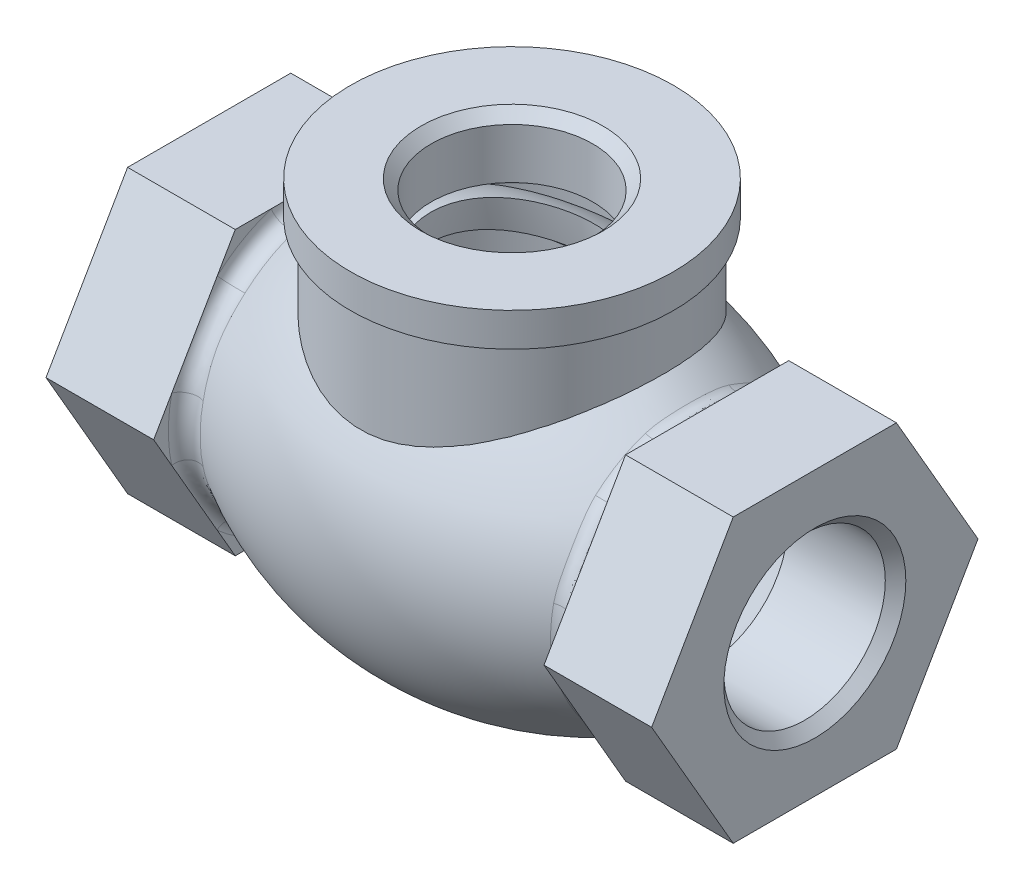
from build123d import *

# Parameters (mm, degrees)
EXTRUDE_1_DEPTH               = 16
HOLE_WIZARD_M27_1_D           = 24
HOLE_WIZARD_M27_1_CSINK_D     = 27.05
HOLE_WIZARD_M27_1_CSINK_ANGLE = 90
FILLET_1_R                    = 2


with BuildPart() as part:
    # 草图2 → 旋转1 (revolve)
    with BuildSketch(Plane.XY, mode=Mode.PRIVATE) as revolve_1_sk:
        with BuildLine():
            Line((-29, 18.552167896), (-29, 13.730823709))
            ThreePointArc((-29, 13.730823709), (0, 23), (29, 13.730823709))
            Line((29, 13.730823709), (29, 18.552167896))
            ThreePointArc((29, 18.552167896), (0, 27), (-29, 18.552167896))
        make_face()
    revolve(revolve_1_sk.sketch.rotate(Axis((-22.917323544, 0, 0), (1, 0, 0)), 90), axis=Axis((-22.917323544, 0, 0), (1, 0, 0)))

    # 草图3 → 凸台-拉伸1 (add)
    with BuildSketch(Plane.ZY.offset(29)):
        Polygon((24.248711306, 0), (12.124355653, 21), (-12.124355653, 21), (-24.248711306, 0), (-12.124355653, -21), (12.124355653, -21), align=None)
    extrude_1 = extrude(amount=EXTRUDE_1_DEPTH)

    # M27 螺纹孔1 (through all)
    with Locations(Plane.ZY.offset(45)):
        with Locations((0, 0)):
            hole_wizard_m27_1 = CounterSinkHole(HOLE_WIZARD_M27_1_D / 2, HOLE_WIZARD_M27_1_CSINK_D / 2, counter_sink_angle=HOLE_WIZARD_M27_1_CSINK_ANGLE)

    # 镜向2: 凸台-拉伸1, M27 螺纹孔1 across plane
    add(extrude_1.mirror(Plane(origin=(0, 0, 0), x_dir=(0, 0, 1), z_dir=(1, 0, 0))))
    add(hole_wizard_m27_1.mirror(Plane(origin=(0, 0, 0), x_dir=(0, 0, 1), z_dir=(1, 0, 0))), mode=Mode.SUBTRACT)


with BuildPart() as body_2:
    # 草图8 → 旋转2 (revolve)
    with BuildSketch(Plane.XY, mode=Mode.PRIVATE) as revolve_2_sk:
        with BuildLine():
            Line((0, 36), (-24, 36))
            Line((-24, 36), (-24, 31))
            Line((-24, 31), (-22.5, 31))
            Line((-22.5, 31), (-22.5, 10))
            ThreePointArc((-22.5, 10), (-19.863961031, 3.636038969), (-13.5, 1))
            Line((-13.5, 1), (-13.5, 7))
            Line((-13.5, 7), (-14, 7))
            ThreePointArc((-14, 7), (-17.535533906, 8.464466094), (-19, 12))
            Line((-19, 12), (-19, 22))
            ThreePointArc((-19, 22), (-17.535533906, 25.535533906), (-14, 27))
            Line((-14, 27), (0, 27))
            Line((0, 27), (0, 36))
        make_face()
    revolve(revolve_2_sk.sketch.rotate(Axis((0, 0, 0), (0, 1, 0)), 270), axis=Axis((0, 0, 0), (0, 1, 0)))


with BuildPart() as hole_wizard_m27_2_tool:
    # M27 螺纹孔2: read off the stored shape, not the designer's step
    # M27 螺纹孔2 outline → M27 螺纹孔2 (revolve)
    with BuildSketch(Plane.XY):
        Polygon((0.328631937, 27), (12, 27), (12, 34.475), (13.525, 36), (0, 36), (0, 26.999), (0.328631937, 26.999), align=None)
    revolve(axis=Axis((0, 0, 0), (0, 1, 0)))


with BuildPart() as part_1:
    add(part.part)

    # M27 螺纹孔2: cut by hole_wizard_m27_2_tool
    add(hole_wizard_m27_2_tool.part, mode=Mode.SUBTRACT)

    # 边界-切除1: read off the stored shape, not the designer's step
    # 边界-切除1: loft between two sections, ruled curve by curve
    other_1_from = [
        Edge.make_bspline([(-5.002603084, 7.059525931, 13.896191561), (-3.183595862, 7.059525931, 14.551030773), (0.714651693, 7.059525931, 15.137835705), (6.45276858, 7.059525931, 13.71175978), (11.208701404, 7.059525931, 10.198819006), (14.258499069, 7.059525931, 5.132980616), (15.137378762, 7.059525931, -0.714153847), (13.711878543, 7.059525931, -6.452719033), (10.19871724, 7.059525931, -11.208680919), (5.133022695, 7.059525931, -14.258470131), (-0.714208217, 7.059525931, -15.137313761), (-6.452649123, 7.059525931, -13.711911442), (-11.20876566, 7.059525931, -10.198716776), (-14.258465608, 7.059525931, -5.133073562), (-15.137394411, 7.059525931, 0.714273575), (-13.711873921, 7.059525931, 6.452526031), (-10.199391638, 7.059525931, 11.20880043), (-6.821610306, 7.059525931, 13.241352349), (-5.002603084, 7.059525931, 13.896191561)], [0, 0, 0, 0, 0.0625, 0.125, 0.1875, 0.25, 0.3125, 0.375, 0.4375, 0.5, 0.5625, 0.625, 0.6875, 0.75, 0.8125, 0.875, 0.9375, 1, 1, 1, 1], 3),
    ]
    other_1_to = [
        Edge.make_bspline([(1.938933286, 27, 11.842319777), (3.48908932, 27, 11.588514004), (6.488564122, 27, 10.465024047), (9.998860866, 27, 7.18513258), (11.987436926, 27, 2.812045761), (12.151039065, 27, -1.989519262), (10.464759197, 27, -6.488030699), (7.185306353, 27, -9.998829782), (2.812017655, 27, -11.987521973), (-1.98946602, 27, -12.15095587), (-6.48812082, 27, -10.464817943), (-9.998846934, 27, -7.185282485), (-11.987437555, 27, -2.811950974), (-12.1510517, 27, 1.989442089), (-10.464728373, 27, 6.488120336), (-7.185367364, 27, 9.998692147), (-2.812372082, 27, 11.987858689), (0.388777252, 27, 12.096125551), (1.938933286, 27, 11.842319777)], [0, 0, 0, 0, 0.0625, 0.125, 0.1875, 0.25, 0.3125, 0.375, 0.4375, 0.5, 0.5625, 0.625, 0.6875, 0.75, 0.8125, 0.875, 0.9375, 1, 1, 1, 1], 3),
    ]
    other_1 = Solid(Shell([*[Face.make_surface_from_curves(other_1_from[k], other_1_to[k]) for k in range(1)], Face(Wire(other_1_from)), Face(Wire(other_1_to))]))
    add(other_1, mode=Mode.SUBTRACT)

    # 圆角1
    fillet_1_edges = [part_1.edges().sort_by_distance(p)[0] for p in [
        (29, 0, -18.552167896),
        (-29, 0, -18.552167896),
    ]]
    fillet(fillet_1_edges, radius=FILLET_1_R)


with BuildPart() as body_2_1:
    add(body_2.part)

    # M27 螺纹孔2: cut by hole_wizard_m27_2_tool
    add(hole_wizard_m27_2_tool.part, mode=Mode.SUBTRACT)

    # 倒角1: read off the stored shape, not the designer's step
    # 倒角1 outline → 倒角1 (revolve, cut)
    with BuildSketch(Plane.XY):
        Polygon((13.5, 7), (13.5, 5.577383711), (14.769230769, 7.059525931), (14, 7.059525931), (14, 7), align=None)
    revolve(axis=Axis((0, 0, 0), (0, 1, 0)), mode=Mode.SUBTRACT)


solid = Compound([part_1.part, body_2_1.part])
